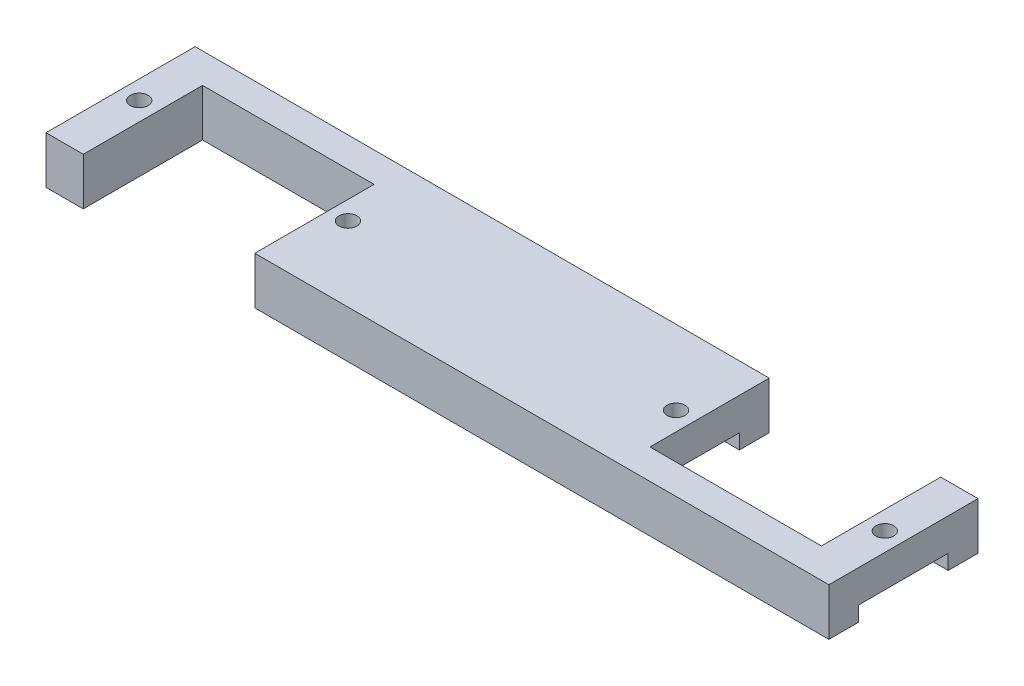
from build123d import *

# Parameters (mm, degrees)
SKETCH1_W            = 105
SKETCH1_H            = 20
BOSS_EXTRUDE1_DEPTH  = 6.35
SKETCH3_W            = 23
SKETCH3_H            = 16
CUT_EXTRUDE1_DEPTH   = 54.819815124
SKETCH4_W            = 5
SKETCH4_H            = 12
CUT_EXTRUDE2_DEPTH   = 2
M2_CLEARANCE_HOLE1_D = 2.4


with BuildPart() as part:
    # Sketch1 → Boss-Extrude1 (new body)
    with BuildSketch(Plane(origin=(0, 0, 0), x_dir=(1, 0, 0), z_dir=(0, 1, 0))):
        Rectangle(SKETCH1_W, SKETCH1_H)
    extrude(amount=BOSS_EXTRUDE1_DEPTH)

    # Sketch3 → Cut-Extrude1 (cut, through all)
    with BuildSketch(Plane(origin=(0, 6.35, 0), x_dir=(1, 0, 0), z_dir=(0, 1, 0))):
        with Locations((-36, -2)):
            Rectangle(SKETCH3_W, SKETCH3_H)
        with Locations((36, 2)):
            Rectangle(SKETCH3_W, SKETCH3_H)
    extrude(amount=-CUT_EXTRUDE1_DEPTH, mode=Mode.SUBTRACT)

    # Sketch4 → Cut-Extrude2 (cut)
    with BuildSketch(Plane.XZ):
        with Locations((22, 0)):
            Rectangle(SKETCH4_W, SKETCH4_H)
        with Locations((50, 0)):
            Rectangle(SKETCH4_W, SKETCH4_H)
    extrude(amount=-CUT_EXTRUDE2_DEPTH, mode=Mode.SUBTRACT)

    # M2 Clearance Hole1 (through all)
    with Locations(Plane(origin=(0, 6.35, 0), x_dir=(1, 0, 0), z_dir=(0, 1, 0))):
        with Locations((50, 0), (-50, 0), (-22, 0), (22, 0)):
            Hole(M2_CLEARANCE_HOLE1_D / 2)


solid = part.part
